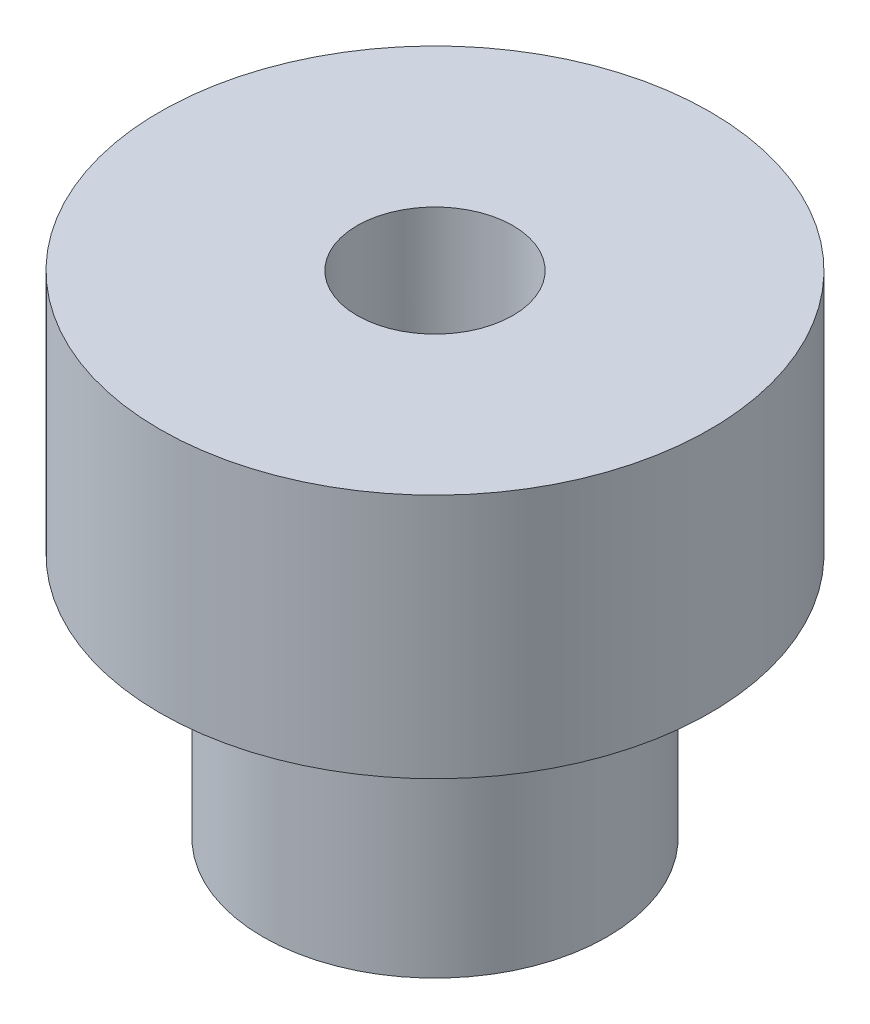
from build123d import *

# Parameters (mm, degrees)
SKETCH1_R           = 5.6
SKETCH1_R_2         = 1.586
BOSS_EXTRUDE1_DEPTH = 5
BOSS_EXTRUDE2_START = 5
SKETCH2_R           = 3.5
SKETCH2_R_2         = 1.586
BOSS_EXTRUDE2_DEPTH = 5
SKETCH3_R           = 1.25
CUT_EXTRUDE1_DEPTH  = 10


with BuildPart() as part:
    # Sketch1 → Boss-Extrude1 (new body)
    with BuildSketch(Plane(origin=(0, 0, 0), x_dir=(1, 0, 0), z_dir=(0, 1, 0))):
        Circle(SKETCH1_R)
        Circle(SKETCH1_R_2, mode=Mode.SUBTRACT)
    extrude(amount=BOSS_EXTRUDE1_DEPTH)

    # Sketch2 → Boss-Extrude2 (add)
    with BuildSketch(Plane.XZ.offset(BOSS_EXTRUDE2_START)):
        Circle(SKETCH2_R)
        Circle(SKETCH2_R_2, mode=Mode.SUBTRACT)
    extrude(amount=-BOSS_EXTRUDE2_DEPTH)

    # Sketch3 → Cut-Extrude1 (cut)
    with BuildSketch(Plane(origin=(0, 0, 0), x_dir=(0, 0, -1), z_dir=(1, 0, 0))):
        with Locations((0, -2.5)):
            Circle(SKETCH3_R)
    extrude(amount=-CUT_EXTRUDE1_DEPTH, mode=Mode.SUBTRACT)


solid = part.part
